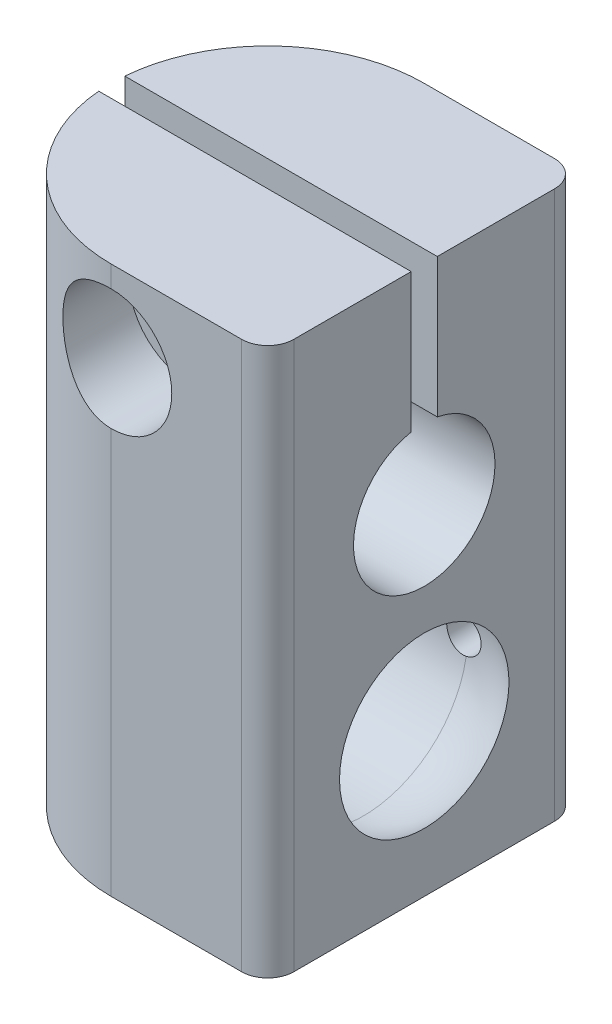
from build123d import *

# Parameters (mm, degrees)
SKETCH1_W               = 19.05
SKETCH1_H               = 19.05
EXTRUDE1_DEPTH          = 33.3375
CUT_EXTRUDE1_DEPTH      = 36.956086498
CUT_EXTRUDE1_DEPTH_BACK = 36.956086498
SKETCH2_R               = 1.7272
FILLET1_START           = 4.7625
FILLET1_OUTLINE_R       = 3.683
FILLET1_OUTLINE_R_2     = 1.7272
FILLET1_DEPTH           = 6.2375
FILLET1_START_2         = -0.79375
FILLET1_2_OUTLINE_R     = 3.683
FILLET1_2_OUTLINE_R_2   = 1.7272
FILLET1_2_DEPTH         = 1.5875
FILLET1_START_3         = 0.79375
FILLET1_3_OUTLINE_R     = 2.2352
FILLET1_3_OUTLINE_R_2   = 1.7272
FILLET1_3_DEPTH         = 3.96875
FILLET1_START_4         = -11
FILLET1_4_OUTLINE_R     = 1.0795
FILLET1_4_DEPTH         = 6.6947
FILLET1_START_5         = -9.525
FILLET1_5_DEPTH         = 19.05
FILLET1_START_6         = 16.48139325
FILLET1_6_OUTLINE_W     = 19.05
FILLET1_6_OUTLINE_H     = 1.5875
FILLET1_6_DEPTH         = 16.85610675
FILLET1_7_DEPTH         = 29.81639325
FILLET1_8_OUTLINE_R     = 1.0795
FILLET1_8_DEPTH         = 2.480030305
SPLIT1_DEPTH            = 33.3375


with BuildPart() as part:
    # Sketch1 → Extrude1 (new body)
    with BuildSketch(Plane(origin=(0, 0, 0), x_dir=(1, 0, 0), z_dir=(0, 1, 0))):
        Rectangle(SKETCH1_W, SKETCH1_H)
    extrude(amount=EXTRUDE1_DEPTH)

    # Sketch2 → Cut-Extrude1 (cut, two sides: drawn at the far end of the back side and taken through both)
    with BuildSketch(Plane.XY.offset(-CUT_EXTRUDE1_DEPTH_BACK)):
        with Locations((0, 28.3464)):
            Circle(SKETCH2_R)
    extrude(amount=CUT_EXTRUDE1_DEPTH + CUT_EXTRUDE1_DEPTH_BACK, mode=Mode.SUBTRACT)


with BuildPart() as body_2:
    # Sketch3 → Revolve1 (revolve)
    with BuildSketch(Plane.XY):
        with BuildLine():
            Line((12.168775296, 8.7376), (-12.7, 8.7376))
            Line((-12.7, 8.7376), (-12.7, 15.0876))
            Line((-12.7, 15.0876), (5.818775296, 15.0876))
            ThreePointArc((5.818775296, 15.0876), (10.308903356, 13.227728061), (12.168775296, 8.7376))
        make_face()
    revolve(axis=Axis((12.168775296, 8.7376, 0), (-1, 0, 0)))


with BuildPart() as part_1:
    add(part.part)

    # Combine1: cut body 2
    add(body_2.part, mode=Mode.SUBTRACT)

    # Fillet1: read off the stored shape, not the designer's step
    # Fillet1 outline → Fillet1 (cut)
    with BuildSketch(Plane.XY.offset(FILLET1_START)):
        with Locations((0, 28.3464)):
            Circle(FILLET1_OUTLINE_R)
        with Locations((0, 28.3464)):
            Circle(FILLET1_OUTLINE_R_2, mode=Mode.SUBTRACT)
    extrude(amount=FILLET1_DEPTH, mode=Mode.SUBTRACT)

    # Fillet1 2 outline → Fillet1 2 (cut)
    with BuildSketch(Plane.XY.offset(FILLET1_START_2)):
        with Locations((0, 28.3464)):
            Circle(FILLET1_2_OUTLINE_R)
        with Locations((0, 28.3464)):
            Circle(FILLET1_2_OUTLINE_R_2, mode=Mode.SUBTRACT)
    extrude(amount=FILLET1_2_DEPTH, mode=Mode.SUBTRACT)

    # Fillet1 3 outline → Fillet1 3 (cut)
    with BuildSketch(Plane.XY.offset(FILLET1_START_3)):
        with Locations((0, 28.3464)):
            Circle(FILLET1_3_OUTLINE_R)
        with Locations((0, 28.3464)):
            Circle(FILLET1_3_OUTLINE_R_2, mode=Mode.SUBTRACT)
    extrude(amount=FILLET1_3_DEPTH, mode=Mode.SUBTRACT)

    # Fillet1 4 outline → Fillet1 4 (cut)
    with BuildSketch(Plane.XY.offset(FILLET1_START_4)):
        with Locations((5.62102, 8.7376)):
            Circle(FILLET1_4_OUTLINE_R)
    extrude(amount=FILLET1_4_DEPTH, mode=Mode.SUBTRACT)

    # Fillet1 5 outline → Fillet1 5 (cut)
    with BuildSketch(Plane.YZ.offset(FILLET1_START_5)):
        with BuildLine():
            Line((33.3375, 0.79375), (24.881697256, 0.79375))
            ThreePointArc((24.881697256, 0.79375), (16.3449, 0), (24.881697256, -0.79375))
            Line((24.881697256, -0.79375), (33.3375, -0.79375))
            Line((33.3375, -0.79375), (33.3375, 0.79375))
        make_face()
    extrude(amount=FILLET1_5_DEPTH, mode=Mode.SUBTRACT)

    # Fillet1 6 outline → Fillet1 6 (cut)
    with BuildSketch(Plane(origin=(0, 0, 0), x_dir=(1, 0, 0), z_dir=(0, 1, 0)).offset(FILLET1_START_6)):
        Rectangle(FILLET1_6_OUTLINE_W, FILLET1_6_OUTLINE_H)
        with BuildLine():
            ThreePointArc((7.9375, 9.525), (9.060032015, 9.060032015), (9.525, 7.9375))
            Line((9.525, 7.9375), (9.525, 9.525))
            Line((9.525, 9.525), (7.9375, 9.525))
        make_face()
        with BuildLine():
            Line((9.525, -9.525), (9.525, -7.9375))
            ThreePointArc((9.525, -7.9375), (9.060032015, -9.060032015), (7.9375, -9.525))
            Line((7.9375, -9.525), (9.525, -9.525))
        make_face()
    extrude(amount=FILLET1_6_DEPTH, mode=Mode.SUBTRACT)

    # Fillet1 7 outline → Fillet1 7 (cut)
    with BuildSketch(Plane(origin=(0, 0, 0), x_dir=(1, 0, 0), z_dir=(0, 1, 0))):
        with BuildLine():
            ThreePointArc((7.9375, 9.525), (9.060032015, 9.060032015), (9.525, 7.9375))
            Line((9.525, 7.9375), (9.525, 9.525))
            Line((9.525, 9.525), (7.9375, 9.525))
        make_face()
        with BuildLine():
            Line((9.525, -9.525), (9.525, -7.9375))
            ThreePointArc((9.525, -7.9375), (9.060032015, -9.060032015), (7.9375, -9.525))
            Line((7.9375, -9.525), (9.525, -9.525))
        make_face()
    extrude(amount=FILLET1_7_DEPTH, mode=Mode.SUBTRACT)

    # Fillet1 8 outline → Fillet1 8 (cut)
    with BuildSketch(Plane(origin=(0, 0, 0), x_dir=(1, 0, 0), z_dir=(0, 1, 0))):
        Circle(FILLET1_8_OUTLINE_R)
    extrude(amount=FILLET1_8_DEPTH, mode=Mode.SUBTRACT)

    # Split1: read off the stored shape, not the designer's step
    # Split1 outline → Split1 (cut)
    with BuildSketch(Plane(origin=(0, 0, 0), x_dir=(1, 0, 0), z_dir=(0, 1, 0))):
        with BuildLine():
            Line((-9.525, 9.525), (-9.525, 0))
            ThreePointArc((-9.525, 0), (-6.735192091, 6.735192091), (0, 9.525))
            Line((0, 9.525), (-9.525, 9.525))
        make_face()
        with BuildLine():
            ThreePointArc((0, -9.525), (-6.735192091, -6.735192091), (-9.525, 0))
            Line((-9.525, 0), (-9.525, -9.525))
            Line((-9.525, -9.525), (0, -9.525))
        make_face()
    extrude(amount=SPLIT1_DEPTH, mode=Mode.SUBTRACT)


solid = part_1.part
